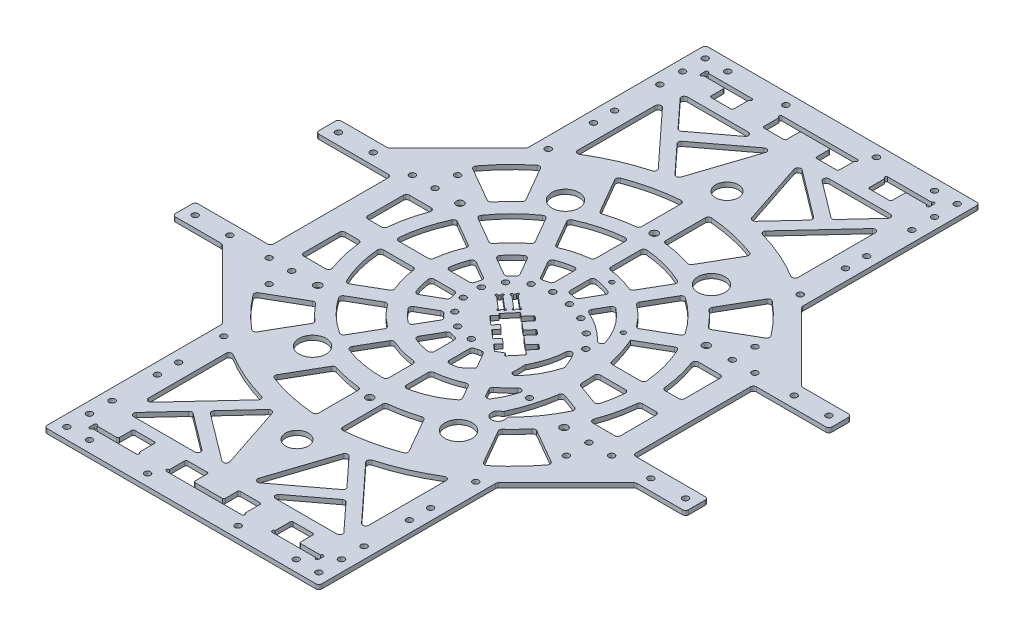
from build123d import *

# Parameters (mm, degrees)
EXTRUDE_2_OUTLINE_R   = 135
EXTRUDE_2_OUTLINE_R_2 = 2
EXTRUDE_2_DEPTH       = 3
SKETCH_7_R            = 2.5
SKETCH_7_R_2          = 1.5
CUT_EXTRUDE_3_DEPTH   = 191.942399692
EXTRUDE_START         = -3
SKETCH_8_R            = 135
EXTRUDE_3_DEPTH       = 3
SKETCH_9_R            = 0.75
SKETCH_9_R_2          = 2
SKETCH_9_W            = 31
SKETCH_9_H            = 3
SKETCH_9_W_2          = 50
SKETCH_9_H_2          = 80
CUT_EXTRUDE_4_DEPTH   = 278.254395817
FILLET_1_R            = 0.5
SKETCH_10_R           = 9
CUT_EXTRUDE_5_DEPTH   = 278.254395817
SKETCH_12_W           = 10
SKETCH_12_H           = 55
SKETCH_12_W_2         = 30
SKETCH_12_H_2         = 10
SKETCH_12_W_3         = 55
EXTRUDE_2_2_DEPTH     = 3
SKETCH_22_R           = 7.5
SKETCH_22_R_2         = 4.25
SKETCH_22_W           = 15
SKETCH_22_H           = 10
CUT_EXTRUDE_10_DEPTH  = 278.254395817
SKETCH_23_R           = 1
CUT_EXTRUDE_11_DEPTH  = 278.254395817
FILLET_2_R            = 2
FILLET_3_R            = 1
FILLET_5_R            = 2


with BuildPart() as part:
    # Extrude 2: read off the stored shape, not the designer's step
    # Extrude 2 outline → Extrude 2 (new body)
    with BuildSketch(Plane(origin=(0, 0, 0), x_dir=(1, 0, 0), z_dir=(0, 1, 0))):
        Circle(EXTRUDE_2_OUTLINE_R)
        with Locations((-11.714860956, -24.326159433)):
            Circle(EXTRUDE_2_OUTLINE_R_2, mode=Mode.SUBTRACT)
        with Locations((-21.109450027, -16.83422465)):
            Circle(EXTRUDE_2_OUTLINE_R_2, mode=Mode.SUBTRACT)
        with Locations((-26.323053629, -6.008065217)):
            Circle(EXTRUDE_2_OUTLINE_R_2, mode=Mode.SUBTRACT)
        with Locations((53.170264489, -41.583325675)):
            Circle(EXTRUDE_2_OUTLINE_R_2, mode=Mode.SUBTRACT)
        with Locations((0, -27)):
            Circle(EXTRUDE_2_OUTLINE_R_2, mode=Mode.SUBTRACT)
        with Locations((-26.323053629, 6.008065217)):
            Circle(EXTRUDE_2_OUTLINE_R_2, mode=Mode.SUBTRACT)
        with Locations((-21.109450027, 16.83422465)):
            Circle(EXTRUDE_2_OUTLINE_R_2, mode=Mode.SUBTRACT)
        with Locations((-11.714860956, 24.326159433)):
            Circle(EXTRUDE_2_OUTLINE_R_2, mode=Mode.SUBTRACT)
        with Locations((0, 27)):
            Circle(EXTRUDE_2_OUTLINE_R_2, mode=Mode.SUBTRACT)
        with Locations((12.54040261, 25.523692772)):
            Circle(EXTRUDE_2_OUTLINE_R_2, mode=Mode.SUBTRACT)
        with Locations((24.405378999, 21.203563613)):
            Circle(EXTRUDE_2_OUTLINE_R_2, mode=Mode.SUBTRACT)
        with Locations((43.695920987, 5.163960602)):
            Circle(EXTRUDE_2_OUTLINE_R_2, mode=Mode.SUBTRACT)
        with Locations((34.975533599, 14.296102982)):
            Circle(EXTRUDE_2_OUTLINE_R_2, mode=Mode.SUBTRACT)
    extrude(amount=EXTRUDE_2_DEPTH)

    # 草图7 → 切除-拉伸3 (cut, through all)
    with BuildSketch(Plane(origin=(0, 3, 0), x_dir=(1, 0, 0), z_dir=(0, 1, 0))):
        with Locations(Location((81.622894307, 47.125, 0), (0, 0, 270))):
            Circle(SKETCH_7_R)
        with Locations(Location((81.622894307, -47.125, 0), (0, 0, 270))):
            Circle(SKETCH_7_R)
        with Locations(Location((0, -94.25, 0), (0, 0, 270))):
            Circle(SKETCH_7_R)
        with Locations(Location((-81.622894307, -47.125, 0), (0, 0, 270))):
            Circle(SKETCH_7_R)
        with Locations(Location((-81.622894307, 47.125, 0), (0, 0, 270))):
            Circle(SKETCH_7_R)
        with Locations(Location((0, 94.25, 0), (0, 0, 270))):
            Circle(SKETCH_7_R)
        with Locations(Location((13.976228436, 52.15999462, 0), (0, 0, 270))):
            Circle(SKETCH_7_R_2)
        with Locations(Location((46.765371804, 27, 0), (0, 0, 270))):
            Circle(SKETCH_7_R_2)
        Polygon((1.215567157, 4.509929222), (-5.400270312, -3.253491067), (20.858357137, -25.630588388), (27.474194606, -17.867168099), align=None)
        Polygon((-10.201227386, 14.23910197), (-12.147061936, 11.955743062), (-3.013626301, 4.172404863), (-1.067791752, 6.455763772), align=None)
        Polygon((-7.68362922, -1.307656517), (-5.737794671, 0.975702391), (-14.871230305, 8.75904059), (-16.817064855, 6.475681681), align=None)
    extrude(amount=-CUT_EXTRUDE_3_DEPTH, mode=Mode.SUBTRACT)

    # 草图8 → 凸台-拉伸3 (add)
    with BuildSketch(Plane(origin=(0, 3, 0), x_dir=(1, 0, 0), z_dir=(0, 1, 0)).offset(EXTRUDE_START)):
        Polygon((170, 55), (170, -55), (137, -55), (91, -101), (91, -219), (-91, -219), (-91, -101), (-137, -55), (-170, -55), (-170, 55), (-137, 55), (-91, 101), (-91, 219), (91, 219), (91, 101), (137, 55), align=None)
        Circle(SKETCH_8_R, mode=Mode.SUBTRACT)
    extrude(amount=EXTRUDE_3_DEPTH)

    # 草图9 → 切除-拉伸4 (cut, through all)
    with BuildSketch(Plane(origin=(0, 3, 0), x_dir=(1, 0, 0), z_dir=(0, 1, 0))):
        with Locations((-3.013626301, 4.172404863)):
            Circle(SKETCH_9_R)
        with Locations((-1.067791752, 6.455763772)):
            Circle(SKETCH_9_R)
        with Locations((-10.201227386, 14.23910197)):
            Circle(SKETCH_9_R)
        with Locations((-12.147061936, 11.955743062)):
            Circle(SKETCH_9_R)
        with Locations((-14.871230305, 8.75904059)):
            Circle(SKETCH_9_R)
        with Locations((-16.817064855, 6.475681681)):
            Circle(SKETCH_9_R)
        with Locations((-5.737794671, 0.975702391)):
            Circle(SKETCH_9_R)
        with Locations((-7.68362922, -1.307656517)):
            Circle(SKETCH_9_R)
        with Locations(Location((162.5, 47.5, 0), (0, 0, 270))):
            Circle(SKETCH_9_R_2)
        with Locations(Location((139.5, 47.5, 0), (0, 0, 270))):
            Circle(SKETCH_9_R_2)
        with Locations(Location((98.5, 62.5, 0), (0, 0, 270))):
            Circle(SKETCH_9_R_2)
        with Locations(Location((98.5, 47.5, 0), (0, 0, 270))):
            Circle(SKETCH_9_R_2)
        with Locations(Location((113.5, 47.5, 0), (0, 0, 270))):
            Circle(SKETCH_9_R_2)
        with Locations(Location((162.5, -47.5, 0), (0, 0, 90))):
            Circle(SKETCH_9_R_2)
        with Locations(Location((139.5, -47.5, 0), (0, 0, 90))):
            Circle(SKETCH_9_R_2)
        with Locations(Location((113.5, -47.5, 0), (0, 0, 90))):
            Circle(SKETCH_9_R_2)
        with Locations(Location((98.5, -47.5, 0), (0, 0, 90))):
            Circle(SKETCH_9_R_2)
        with Locations(Location((98.5, -62.5, 0), (0, 0, 90))):
            Circle(SKETCH_9_R_2)
        with Locations(Location((-98.5, -62.5, 0), (0, 0, 270))):
            Circle(SKETCH_9_R_2)
        with Locations(Location((-98.5, -47.5, 0), (0, 0, 270))):
            Circle(SKETCH_9_R_2)
        with Locations(Location((-113.5, -47.5, 0), (0, 0, 270))):
            Circle(SKETCH_9_R_2)
        with Locations(Location((-139.5, -47.5, 0), (0, 0, 270))):
            Circle(SKETCH_9_R_2)
        with Locations(Location((-162.5, -47.5, 0), (0, 0, 270))):
            Circle(SKETCH_9_R_2)
        with Locations(Location((-113.5, 47.5, 0), (0, 0, 90))):
            Circle(SKETCH_9_R_2)
        with Locations(Location((-98.5, 47.5, 0), (0, 0, 90))):
            Circle(SKETCH_9_R_2)
        with Locations(Location((-98.5, 62.5, 0), (0, 0, 90))):
            Circle(SKETCH_9_R_2)
        with Locations(Location((-139.5, 47.5, 0), (0, 0, 90))):
            Circle(SKETCH_9_R_2)
        with Locations(Location((-162.5, 47.5, 0), (0, 0, 90))):
            Circle(SKETCH_9_R_2)
        with Locations(Location((68.5, 211.5, 0), (0, 0, 270))):
            Circle(SKETCH_9_R_2)
        with Locations(Location((83.5, 211.5, 0), (0, 0, 270))):
            Circle(SKETCH_9_R_2)
        with Locations(Location((83.5, 196.5, 0), (0, 0, 270))):
            Circle(SKETCH_9_R_2)
        with Locations(Location((83.5, 181.5, 0), (0, 0, 270))):
            Circle(SKETCH_9_R_2)
        with Locations(Location((83.5, 151.5, 0), (0, 0, 270))):
            Circle(SKETCH_9_R_2)
        with Locations(Location((83.5, -181.5, 0), (0, 0, 90))):
            Circle(SKETCH_9_R_2)
        with Locations(Location((83.5, -196.5, 0), (0, 0, 90))):
            Circle(SKETCH_9_R_2)
        with Locations(Location((83.5, -211.5, 0), (0, 0, 90))):
            Circle(SKETCH_9_R_2)
        with Locations(Location((68.5, -211.5, 0), (0, 0, 90))):
            Circle(SKETCH_9_R_2)
        with Locations(Location((-83.5, 181.5, 0), (0, 0, 90))):
            Circle(SKETCH_9_R_2)
        with Locations(Location((-83.5, 196.5, 0), (0, 0, 90))):
            Circle(SKETCH_9_R_2)
        with Locations(Location((-83.5, 211.5, 0), (0, 0, 90))):
            Circle(SKETCH_9_R_2)
        with Locations(Location((-68.5, 211.5, 0), (0, 0, 90))):
            Circle(SKETCH_9_R_2)
        with Locations(Location((-68.5, -211.5, 0), (0, 0, 270))):
            Circle(SKETCH_9_R_2)
        with Locations(Location((-83.5, -211.5, 0), (0, 0, 270))):
            Circle(SKETCH_9_R_2)
        with Locations(Location((-83.5, -196.5, 0), (0, 0, 270))):
            Circle(SKETCH_9_R_2)
        with Locations(Location((-83.5, -181.5, 0), (0, 0, 270))):
            Circle(SKETCH_9_R_2)
        with Locations(Location((30, 211.5, 0), (0, 0, 270))):
            Circle(SKETCH_9_R_2)
        with Locations(Location((-30, 211.5, 0), (0, 0, 90))):
            Circle(SKETCH_9_R_2)
        with Locations(Location((-30, -211.5, 0), (0, 0, 270))):
            Circle(SKETCH_9_R_2)
        with Locations(Location((30, -211.5, 0), (0, 0, 90))):
            Circle(SKETCH_9_R_2)
        with Locations(Location((83.5, 137.5, 0), (0, 0, 270))):
            Circle(SKETCH_9_R_2)
        with Locations(Location((83.5, 107.5, 0), (0, 0, 270))):
            Circle(SKETCH_9_R_2)
        with Locations(Location((-83.5, 107.5, 0), (0, 0, 90))):
            Circle(SKETCH_9_R_2)
        with Locations(Location((-83.5, 137.5, 0), (0, 0, 90))):
            Circle(SKETCH_9_R_2)
        with Locations(Location((-83.5, 151.5, 0), (0, 0, 90))):
            Circle(SKETCH_9_R_2)
        with Locations(Location((83.5, -151.5, 0), (0, 0, 90))):
            Circle(SKETCH_9_R_2)
        with Locations(Location((-83.5, -151.5, 0), (0, 0, 270))):
            Circle(SKETCH_9_R_2)
        with Locations(Location((83.5, -107.5, 0), (0, 0, 90))):
            Circle(SKETCH_9_R_2)
        with Locations(Location((83.5, -137.5, 0), (0, 0, 90))):
            Circle(SKETCH_9_R_2)
        with Locations(Location((-83.5, -137.5, 0), (0, 0, 270))):
            Circle(SKETCH_9_R_2)
        with Locations(Location((-83.5, -107.5, 0), (0, 0, 270))):
            Circle(SKETCH_9_R_2)
        Polygon((16.391664776, 0.117201019), (5.559852449, -12.593496905), (4.30400505, -11.523287903), (1.385253225, -14.948326266), (7.093650497, -19.81291264), (10.012402321, -16.387874277), (8.756554921, -15.317665275), (19.588367248, -2.606967351), align=None)
        Polygon((-4.296646839, -4.193977766), (-7.215398664, -7.619016129), (-1.507001392, -12.483602503), (1.411750432, -9.05856414), (0.155903032, -7.988355138), (10.987715359, 4.722342786), (7.791012887, 7.446511156), (-3.04079944, -5.264186768), align=None)
        Polygon((17.813878592, -23.036142322), (28.645690918, -10.325444398), (25.448988446, -7.601276028), (14.61717612, -20.311973952), (13.36132872, -19.24176495), (10.442576896, -22.666803313), (16.150974167, -27.531389687), (19.069725992, -24.106351324), align=None)
        with Locations((-60.5, 202.5)):
            Rectangle(SKETCH_9_W, SKETCH_9_H)
        with Locations((60.5, 202.5)):
            Rectangle(SKETCH_9_W, SKETCH_9_H)
        with Locations((-145, 0)):
            Rectangle(SKETCH_9_W_2, SKETCH_9_H_2)
        with Locations((145, 0)):
            Rectangle(SKETCH_9_W_2, SKETCH_9_H_2)
        with Locations((0, 202.5)):
            Rectangle(SKETCH_9_W_2, SKETCH_9_H)
        with Locations((-60.5, -202.5)):
            Rectangle(SKETCH_9_W, SKETCH_9_H)
        with Locations((0, -202.5)):
            Rectangle(SKETCH_9_W_2, SKETCH_9_H)
        with Locations((60.5, -202.5)):
            Rectangle(SKETCH_9_W, SKETCH_9_H)
    extrude(amount=-CUT_EXTRUDE_4_DEPTH, mode=Mode.SUBTRACT)

    # 圆角1
    fillet_1_edges = [part.edges().sort_by_distance(p)[0] for p in [
        (1.215567157, 1.5, -4.509929222),
        (27.474194606, 1.5, 17.867168099),
        (20.858357137, 1.5, 25.630588388),
        (-5.400270312, 1.5, 3.253491067),
        (19.588367248, 1.5, 2.606967351),
        (1.385253225, 1.5, 14.948326266),
        (16.391664776, 1.5, -0.117201019),
        (7.093650497, 1.5, 19.81291264),
        (28.645690918, 1.5, 10.325444398),
        (10.442576896, 1.5, 22.666803313),
        (25.448988446, 1.5, 7.601276028),
        (16.150974167, 1.5, 27.531389687),
        (10.987715359, 1.5, -4.722342786),
        (7.791012887, 1.5, -7.446511156),
        (-1.507001392, 1.5, 12.483602503),
        (-7.215398664, 1.5, 7.619016129),
    ]]
    fillet(fillet_1_edges, radius=FILLET_1_R)

    # 草图10 → 切除-拉伸5 (cut, through all)
    with BuildSketch(Plane(origin=(0, 3, 0), x_dir=(1, 0, 0), z_dir=(0, 1, 0))):
        with Locations(Location((-48.375, 83.787957816, 0), (0, 0, 270))):
            Circle(SKETCH_10_R)
        with Locations(Location((48.375, 83.787957816, 0), (0, 0, 270))):
            Circle(SKETCH_10_R)
        with Locations(Location((48.375, -83.787957816, 0), (0, 0, 270))):
            Circle(SKETCH_10_R)
        with Locations(Location((-48.375, -83.787957816, 0), (0, 0, 270))):
            Circle(SKETCH_10_R)
        with BuildLine():
            ThreePointArc((54.807599699, 21.843237289), (-58.035185112, 10.626254705), (43.512352912, -39.845641469))
            ThreePointArc((43.512352912, -39.845641469), (45.966882899, -39.452635002), (46.908234228, -41.753293433))
            ThreePointArc((46.908234228, -41.753293433), (35.725023116, -61.49758579), (16.859238941, -74.106450882))
            ThreePointArc((16.859238941, -74.106450882), (-26.987401916, -76.117709483), (-63.833064957, -52.264613442))
            ThreePointArc((-63.833064957, -52.264613442), (6.543748569, 82.240071466), (54.764925772, -61.701320125))
            ThreePointArc((54.764925772, -61.701320125), (52.225261686, -61.796437344), (51.642704378, -59.322661297))
            ThreePointArc((51.642704378, -59.322661297), (61.837427116, -19.075529749), (54.807599699, 21.843237289))
        make_face()
        with BuildLine():
            ThreePointArc((48.483149933, 7.098180936), (-40.861999704, 27.042503216), (12.415555235, -47.400991426))
            ThreePointArc((12.415555235, -47.400991426), (18.681796727, -41.317756254), (22.242880009, -33.343408729))
            ThreePointArc((22.242880009, -33.343408729), (22.008638881, -31.855621383), (20.802882397, -30.953107455))
            ThreePointArc((20.802882397, -30.953107455), (14.460540203, -30.135222653), (8.118198009, -30.953107455))
            ThreePointArc((8.118198009, -30.953107455), (-31.737197725, -4.092710662), (4.1e-08, 32))
            ThreePointArc((4.1e-08, 32), (6.898084414, 31.595361796), (13.701550903, 30.386997681))
            ThreePointArc((13.701550903, 30.386997681), (33.185077819, 21.868055327), (48.483149933, 7.098180936))
        make_face()
        with BuildLine():
            ThreePointArc((31.462480379, -37.564775101), (32.728244708, -30.923894341), (32.618689385, -24.164348924))
            ThreePointArc((32.618689385, -24.164348924), (37.70981937, -10.922222356), (38.876667523, 3.216801159))
            ThreePointArc((38.876667523, 3.216801159), (43.832931918, -4.268743283), (47.373891096, -12.518563914))
            ThreePointArc((47.373891096, -12.518563914), (41.359660788, -26.275053939), (31.462480379, -37.564775101))
        make_face()
    extrude(amount=-CUT_EXTRUDE_5_DEPTH, mode=Mode.SUBTRACT)

    # 草图12 → Extrude 2 2 (add)
    with BuildSketch(Plane(origin=(0, 3, 0), x_dir=(1, 0, 0), z_dir=(0, 1, 0))):
        with Locations((0, 56.5)):
            Rectangle(SKETCH_12_W, SKETCH_12_H)
        Polygon((19.700243076, 24.121821929), (46.330127019, 70.246133918), (37.669872981, 75.246133918), (11.039989038, 29.121821929), align=None)
        Polygon((50.997422612, 23.669872981), (75.246133918, 37.669872981), (70.246133918, 46.330127019), (45.997422612, 32.330127019), align=None)
        with Locations((69, 0)):
            Rectangle(SKETCH_12_W_2, SKETCH_12_H_2)
        Polygon((10.798129487, -28.702908898), (37.669872981, -75.246133918), (46.330127019, -70.246133918), (19.458383525, -23.702908898), align=None)
        with Locations((0, -56.5)):
            Rectangle(SKETCH_12_W, SKETCH_12_H)
        Polygon((-18.792378281, -22.549353978), (-46.330127019, -70.246133918), (-37.669872981, -75.246133918), (-10.132124243, -27.549353978), align=None)
        Polygon((-27.61473671, -10.169872981), (-75.246133918, -37.669872981), (-70.246133918, -46.330127019), (-22.61473671, -18.830127019), align=None)
        with Locations((-56.5, 0)):
            Rectangle(SKETCH_12_W_3, SKETCH_12_H_2)
        Polygon((-22.61473671, 18.830127019), (-70.246133918, 46.330127019), (-75.246133918, 37.669872981), (-27.61473671, 10.169872981), align=None)
        Polygon((-10.169872981, 27.61473671), (-37.669872981, 75.246133918), (-46.330127019, 70.246133918), (-18.830127019, 22.61473671), align=None)
        Polygon((49.033300806, -23.167550844), (77.224079429, -33.428155143), (80.644280863, -24.031228935), (52.453502239, -13.770624636), align=None)
    extrude(amount=-EXTRUDE_2_2_DEPTH)

    # 草图22 → 切除-拉伸10 (cut, through all)
    with BuildSketch(Plane(origin=(0, 3, 0), x_dir=(1, 0, 0), z_dir=(0, 1, 0))):
        with Locations(Location((0, 142.5, 0), (0, 0, 270))):
            Circle(SKETCH_22_R)
        with Locations((53.155598978, -62.437827455)):
            Circle(SKETCH_22_R_2)
        with Locations(Location((0, -142.5, 0), (0, 0, 90))):
            Circle(SKETCH_22_R)
        with BuildLine():
            Line((-105, 7.5), (-105, 35))
            Line((-105, 35), (-85.622718948, 35))
            ThreePointArc((-85.622718948, 35), (-89.966034254, 21.502620318), (-92.195444573, 7.5))
            Line((-92.195444573, 7.5), (-105, 7.5))
        make_face()
        with BuildLine():
            Line((29.77741647, 87.575998244), (44.996710059, 113.936587995))
            ThreePointArc((44.996710059, 113.936587995), (26.821507042, 119.527640151), (8, 122.238496391))
            Line((8, 122.238496391), (8, 92.153404712))
            ThreePointArc((8, 92.153404712), (19.026861572, 90.521978208), (29.77741647, 87.575998244))
        make_face()
        with BuildLine():
            Line((92.195444573, 7.5), (105, 7.5))
            Line((105, 7.5), (105, 35))
            Line((105, 35), (85.622718948, 35))
            ThreePointArc((85.622718948, 35), (89.966034254, 21.502620318), (92.195444573, 7.5))
        make_face()
        with BuildLine():
            Line((72.812278368, 57.049295515), (98.989039715, 72.162455725))
            ThreePointArc((98.989039715, 72.162455725), (88.384342976, 84.820150417), (76.173624595, 95.936587995))
            Line((76.173624595, 95.936587995), (60.954331006, 69.575998244))
            ThreePointArc((60.954331006, 69.575998244), (67.175933311, 63.589653119), (72.812278368, 57.049295515))
        make_face()
        with BuildLine():
            Line((105, -35), (85.622718948, -35))
            ThreePointArc((85.622718948, -35), (89.966034254, -21.502620318), (92.195444573, -7.5))
            Line((92.195444573, -7.5), (105, -7.5))
            Line((105, -7.5), (105, -35))
        make_face()
        with BuildLine():
            Line((33.504478555, 130.260124047), (73, 172.96570276))
            Line((73, 172.96570276), (73, 112.96570276))
            ThreePointArc((73, 112.96570276), (53.949747358, 123.205822752), (33.504478555, 130.260124047))
        make_face()
        with BuildLine():
            Line((-73, 172.96570276), (-73, 112.96570276))
            ThreePointArc((-73, 112.96570276), (-53.949747358, 123.205822752), (-33.504478555, 130.260124047))
            Line((-33.504478555, 130.260124047), (-73, 172.96570276))
        make_face()
        with BuildLine():
            Line((-60.954331006, 69.575998244), (-76.173624595, 95.936587995))
            ThreePointArc((-76.173624595, 95.936587995), (-88.384342976, 84.820150417), (-98.989039715, 72.162455725))
            Line((-98.989039715, 72.162455725), (-72.812278368, 57.049295515))
            ThreePointArc((-72.812278368, 57.049295515), (-67.175933311, 63.589653119), (-60.954331006, 69.575998244))
        make_face()
        with BuildLine():
            Line((-8, 92.153404712), (-8, 122.238496391))
            ThreePointArc((-8, 122.238496391), (-26.821507042, 119.527640151), (-44.996710059, 113.936587995))
            Line((-44.996710059, 113.936587995), (-29.77741647, 87.575998244))
            ThreePointArc((-29.77741647, 87.575998244), (-19.026861572, 90.521978208), (-8, 92.153404712))
        make_face()
        with BuildLine():
            Line((72.812278368, -57.049295515), (98.989039715, -72.162455725))
            ThreePointArc((98.989039715, -72.162455725), (88.384342976, -84.820150417), (76.173624595, -95.936587995))
            Line((76.173624595, -95.936587995), (60.954331006, -69.575998244))
            ThreePointArc((60.954331006, -69.575998244), (67.175933311, -63.589653119), (72.812278368, -57.049295515))
        make_face()
        with BuildLine():
            Line((-29.77741647, -87.575998244), (-44.996710059, -113.936587995))
            ThreePointArc((-44.996710059, -113.936587995), (-26.821507042, -119.527640151), (-8, -122.238496391))
            Line((-8, -122.238496391), (-8, -92.153404712))
            ThreePointArc((-8, -92.153404712), (-19.026861572, -90.521978208), (-29.77741647, -87.575998244))
        make_face()
        with BuildLine():
            Line((-72.812278368, -57.049295515), (-98.989039715, -72.162455725))
            ThreePointArc((-98.989039715, -72.162455725), (-88.384342976, -84.820150417), (-76.173624595, -95.936587995))
            Line((-76.173624595, -95.936587995), (-60.954331006, -69.575998244))
            ThreePointArc((-60.954331006, -69.575998244), (-67.175933311, -63.589653119), (-72.812278368, -57.049295515))
        make_face()
        with BuildLine():
            Line((8, -92.153404712), (8, -122.238496391))
            ThreePointArc((8, -122.238496391), (26.821507042, -119.527640151), (44.996710059, -113.936587995))
            Line((44.996710059, -113.936587995), (29.77741647, -87.575998244))
            ThreePointArc((29.77741647, -87.575998244), (19.026861572, -90.521978208), (8, -92.153404712))
        make_face()
        with BuildLine():
            Line((-92.195444573, -7.5), (-105, -7.5))
            Line((-105, -7.5), (-105, -35))
            Line((-105, -35), (-85.622718948, -35))
            ThreePointArc((-85.622718948, -35), (-89.966034254, -21.502620318), (-92.195444573, -7.5))
        make_face()
        with Locations((-52.5, 196)):
            Rectangle(SKETCH_22_W, SKETCH_22_H)
        with Locations((-17.5, 196)):
            Rectangle(SKETCH_22_W, SKETCH_22_H)
        with Locations((17.5, 196)):
            Rectangle(SKETCH_22_W, SKETCH_22_H)
        with Locations((52.5, 196)):
            Rectangle(SKETCH_22_W, SKETCH_22_H)
        with Locations((52.5, -196)):
            Rectangle(SKETCH_22_W, SKETCH_22_H)
        with Locations((17.5, -196)):
            Rectangle(SKETCH_22_W, SKETCH_22_H)
        with Locations((-17.5, -196)):
            Rectangle(SKETCH_22_W, SKETCH_22_H)
        with Locations((-52.5, -196)):
            Rectangle(SKETCH_22_W, SKETCH_22_H)
        Polygon((20.793956755, 183.5), (71.845665855, 183.5), (50.880248519, 160.830587178), align=None)
        Polygon((7.5, 183.5), (45.420816185, 154.927431358), (24.455398849, 132.258018536), align=None)
        Polygon((-20.793956755, 183.5), (-71.845665855, 183.5), (-50.880248519, 160.830587178), align=None)
        Polygon((-24.455398849, 132.258018536), (-7.5, 183.5), (-45.420816185, 154.927431358), align=None)
        with BuildLine():
            Line((-73, -172.96570276), (-73, -112.96570276))
            ThreePointArc((-73, -112.96570276), (-53.949747358, -123.205822752), (-33.504478555, -130.260124047))
            Line((-33.504478555, -130.260124047), (-73, -172.96570276))
        make_face()
        Polygon((-20.793956755, -183.5), (-71.845665855, -183.5), (-50.880248519, -160.830587178), align=None)
        Polygon((-7.5, -183.5), (-45.420816185, -154.927431358), (-24.455398849, -132.258018536), align=None)
        Polygon((24.455398849, -132.258018536), (7.5, -183.5), (45.420816185, -154.927431358), align=None)
        Polygon((50.880248519, -160.830587178), (20.793956755, -183.5), (71.845665855, -183.5), align=None)
        with BuildLine():
            Line((73, -172.96570276), (73, -112.96570276))
            ThreePointArc((73, -112.96570276), (53.949747358, -123.205822752), (33.504478555, -130.260124047))
            Line((33.504478555, -130.260124047), (73, -172.96570276))
        make_face()
    extrude(amount=-CUT_EXTRUDE_10_DEPTH, mode=Mode.SUBTRACT)

    # 草图23 → 切除-拉伸11 (cut, through all)
    with BuildSketch(Plane(origin=(0, 3, 0), x_dir=(1, 0, 0), z_dir=(0, 1, 0))):
        with Locations((75, 204)):
            Circle(SKETCH_23_R)
        with Locations((75, 201)):
            Circle(SKETCH_23_R)
        with Locations((45, 203)):
            Circle(SKETCH_23_R)
        with Locations((25, 203)):
            Circle(SKETCH_23_R)
        with Locations((-25, 203)):
            Circle(SKETCH_23_R)
        with Locations((-45, 203)):
            Circle(SKETCH_23_R)
        with Locations((-75, 201)):
            Circle(SKETCH_23_R)
        with Locations((-75, 204)):
            Circle(SKETCH_23_R)
        with Locations((-75, -204)):
            Circle(SKETCH_23_R)
        with Locations((-75, -201)):
            Circle(SKETCH_23_R)
        with Locations((-45, -203)):
            Circle(SKETCH_23_R)
        with Locations((-25, -203)):
            Circle(SKETCH_23_R)
        with Locations((25, -203)):
            Circle(SKETCH_23_R)
        with Locations((45, -203)):
            Circle(SKETCH_23_R)
        with Locations((75, -201)):
            Circle(SKETCH_23_R)
        with Locations((75, -204)):
            Circle(SKETCH_23_R)
    extrude(amount=-CUT_EXTRUDE_11_DEPTH, mode=Mode.SUBTRACT)

    # 圆角2
    fillet_2_edges = [part.edges().sort_by_distance(p)[0] for p in [
        (91, 1.5, -101),
        (91, 1.5, -219),
        (-91, 1.5, -219),
        (-91, 1.5, -101),
        (-137, 1.5, -55),
        (-170, 1.5, -55),
        (-170, 1.5, 55),
        (-137, 1.5, 55),
        (-91, 1.5, 101),
        (-91, 1.5, 219),
        (91, 1.5, 219),
        (91, 1.5, 101),
        (137, 1.5, 55),
        (170, 1.5, 55),
        (170, 1.5, -55),
        (137, 1.5, -55),
        (52.132492981, 1.5, 58.312811804),
        (56.631666777, 1.5, 59.992535519),
        (-170, 1.5, 40),
        (-170, 1.5, -40),
        (170, 1.5, -40),
        (170, 1.5, 40),
    ]]
    fillet(fillet_2_edges, radius=FILLET_2_R)

    # 圆角3
    fillet_3_edges = [part.edges().sort_by_distance(p)[0] for p in [
        (45, 1.5, 191),
        (60, 1.5, 191),
        (60, 1.5, 201),
        (60, 1.5, -201),
        (60, 1.5, -191),
        (45, 1.5, -191),
        (25, 1.5, 191),
        (10, 1.5, 201),
        (10, 1.5, 191),
        (-10, 1.5, 201),
        (-25, 1.5, 191),
        (-10, 1.5, 191),
        (-60, 1.5, 201),
        (-60, 1.5, 191),
        (-45, 1.5, 191),
        (-45, 1.5, -191),
        (-60, 1.5, -191),
        (-60, 1.5, -201),
        (-25, 1.5, -191),
        (-10, 1.5, -201),
        (-10, 1.5, -191),
        (10, 1.5, -201),
        (25, 1.5, -191),
        (10, 1.5, -191),
    ]]
    fillet(fillet_3_edges, radius=FILLET_3_R)

    # 圆角5
    fillet_5_edges = [part.edges().sort_by_distance(p)[0] for p in [
        (68.815759128, 1.5, -45.504299749),
        (73.815759128, 1.5, -36.844045711),
        (28.702242233, 1.5, -39.713741838),
        (20.041988195, 1.5, -44.713741838),
        (36.844045711, 1.5, -73.815759128),
        (25.063749894, 1.5, -53.411688245),
        (11.990804111, 1.5, -30.768681943),
        (33.724003932, 1.5, -48.411688245),
        (21.836777721, 1.5, -27.822408486),
        (45.504299749, 1.5, -68.815759128),
        (31.877025819, 1.5, 65.212628312),
        (39.010317683, 1.5, 57.567852247),
        (33.724003932, 1.5, 48.411688245),
        (11.712538572, 1.5, 30.286711892),
        (25.063749894, 1.5, 53.411688245),
        (61.393933446, 1.5, 5),
        (59.856203068, 1.5, -5),
        (82.34834546, 1.5, -5),
        (82.34834546, 1.5, 5),
        (-5, 1.5, 78.543952843),
        (5, 1.5, 77.392922847),
        (5, 1.5, 31.606961259),
        (5, 1.5, 48.744230428),
        (5, 1.5, 58.787753827),
        (-5, 1.5, 31.606961259),
        (-5, 1.5, 48.744230428),
        (-5, 1.5, 58.787753827),
        (-45.232822915, 1.5, 68.345547458),
        (-36.311139386, 1.5, 72.892738297),
        (-11.47335361, 1.5, 29.872431386),
        (-20.041988195, 1.5, 44.713741838),
        (-25.063749894, 1.5, 53.411688245),
        (-20.133607648, 1.5, 24.872431386),
        (-28.702242233, 1.5, 39.713741838),
        (-33.724003932, 1.5, 48.411688245),
        (-24.872431386, 1.5, 20.133607648),
        (-39.713741838, 1.5, 28.702242233),
        (-68.815759128, 1.5, 45.504299749),
        (-48.411688245, 1.5, 33.724003932),
        (-29.872431386, 1.5, 11.47335361),
        (-53.411688245, 1.5, 25.063749894),
        (-44.713741838, 1.5, 20.041988195),
        (-73.815759128, 1.5, 36.844045711),
        (-31.606961259, 1.5, 5),
        (-48.744230428, 1.5, 5),
        (-82.34834546, 1.5, 5),
        (-58.787753827, 1.5, 5),
        (-31.606961259, 1.5, -5),
        (-58.787753827, 1.5, -5),
        (-48.744230428, 1.5, -5),
        (-82.34834546, 1.5, -5),
        (-29.872431386, 1.5, -11.47335361),
        (-44.713741838, 1.5, -20.041988195),
        (-73.815759128, 1.5, -36.844045711),
        (-53.411688245, 1.5, -25.063749894),
        (-24.872431386, 1.5, -20.133607648),
        (-48.411688245, 1.5, -33.724003932),
        (-39.713741838, 1.5, -28.702242233),
        (-68.815759128, 1.5, -45.504299749),
        (-20.133607648, 1.5, -24.872431386),
        (-28.702242233, 1.5, -39.713741838),
        (-45.504299749, 1.5, -68.815759128),
        (-33.724003932, 1.5, -48.411688245),
        (-11.47335361, 1.5, -29.872431386),
        (-25.063749894, 1.5, -53.411688245),
        (-20.041988195, 1.5, -44.713741838),
        (-36.844045711, 1.5, -73.815759128),
        (61.142133613, 1.5, 27.574805557),
        (61.892816049, 1.5, 17.206253894),
        (79.092233279, 1.5, 23.466329813),
        (75.672031846, 1.5, 32.863256021),
        (8, 1.5, 92.153404712),
        (29.77741647, 1.5, 87.575998244),
        (44.996710059, 1.5, 113.936587995),
        (8, 1.5, 122.238496391),
        (33.504478555, 1.5, 130.260124047),
        (73, 1.5, 112.96570276),
        (73, 1.5, 172.96570276),
        (-105, 1.5, 35),
        (-105, 1.5, 7.5),
        (-92.195444573, 1.5, 7.5),
        (-85.622718948, 1.5, 35),
        (-8, 1.5, 122.238496391),
        (-44.996710059, 1.5, 113.936587995),
        (-29.77741647, 1.5, 87.575998244),
        (-8, 1.5, 92.153404712),
        (-72.812278368, 1.5, 57.049295515),
        (-60.954331006, 1.5, 69.575998244),
        (-76.173624595, 1.5, 95.936587995),
        (-98.989039715, 1.5, 72.162455725),
        (-73, 1.5, 112.96570276),
        (-33.504478555, 1.5, 130.260124047),
        (-73, 1.5, 172.96570276),
        (-50.880248519, 1.5, 160.830587178),
        (-20.793956755, 1.5, 183.5),
        (-71.845665855, 1.5, 183.5),
        (-24.455398849, 1.5, 132.258018536),
        (-7.5, 1.5, 183.5),
        (-45.420816185, 1.5, 154.927431358),
        (-20.793956755, 1.5, -183.5),
        (-50.880248519, 1.5, -160.830587178),
        (-71.845665855, 1.5, -183.5),
        (-24.455398849, 1.5, -132.258018536),
        (-45.420816185, 1.5, -154.927431358),
        (-7.5, 1.5, -183.5),
        (-85.622718948, 1.5, -35),
        (-92.195444573, 1.5, -7.5),
        (-105, 1.5, -7.5),
        (-105, 1.5, -35),
        (73, 1.5, -112.96570276),
        (33.504478555, 1.5, -130.260124047),
        (73, 1.5, -172.96570276),
        (105, 1.5, -35),
        (105, 1.5, -7.5),
        (92.195444573, 1.5, -7.5),
        (85.622718948, 1.5, -35),
        (50.880248519, 1.5, -160.830587178),
        (20.793956755, 1.5, -183.5),
        (71.845665855, 1.5, -183.5),
        (105, 1.5, 7.5),
        (105, 1.5, 35),
        (85.622718948, 1.5, 35),
        (92.195444573, 1.5, 7.5),
        (76.173624595, 1.5, -95.936587995),
        (98.989039715, 1.5, -72.162455725),
        (72.812278368, 1.5, -57.049295515),
        (60.954331006, 1.5, -69.575998244),
        (60.954331006, 1.5, 69.575998244),
        (72.812278368, 1.5, 57.049295515),
        (98.989039715, 1.5, 72.162455725),
        (76.173624595, 1.5, 95.936587995),
        (24.455398849, 1.5, -132.258018536),
        (7.5, 1.5, -183.5),
        (45.420816185, 1.5, -154.927431358),
        (-33.504478555, 1.5, -130.260124047),
        (-73, 1.5, -112.96570276),
        (-73, 1.5, -172.96570276),
        (-98.989039715, 1.5, -72.162455725),
        (-76.173624595, 1.5, -95.936587995),
        (-60.954331006, 1.5, -69.575998244),
        (-72.812278368, 1.5, -57.049295515),
        (-8, 1.5, -92.153404712),
        (-29.77741647, 1.5, -87.575998244),
        (-44.996710059, 1.5, -113.936587995),
        (-8, 1.5, -122.238496391),
        (50.880248519, 1.5, 160.830587178),
        (71.845665855, 1.5, 183.5),
        (20.793956755, 1.5, 183.5),
        (24.455398849, 1.5, 132.258018536),
        (45.420816185, 1.5, 154.927431358),
        (7.5, 1.5, 183.5),
        (29.77741647, 1.5, -87.575998244),
        (8, 1.5, -92.153404712),
        (8, 1.5, -122.238496391),
        (44.996710059, 1.5, -113.936587995),
        (-120, 1.5, -40),
        (-120, 1.5, 40),
        (120, 1.5, -40),
        (120, 1.5, 40),
        (48.483149933, 1.5, -7.098180936),
        (47.373891096, 1.5, 12.518563914),
        (31.462480379, 1.5, 37.564775101),
        (32.618689385, 1.5, 24.164348924),
        (38.876667523, 1.5, -3.216801159),
        (5, 1.5, -58.787753827),
        (-5, 1.5, -58.787753827),
        (-5, 1.5, -31.606961259),
        (-5, 1.5, -48.744230428),
        (-5, 1.5, -82.34834546),
        (5, 1.5, -31.787753768),
        (5, 1.5, -48.744230428),
        (5, 1.5, -82.34834546),
        (48.411688245, 1.5, -33.724003932),
    ]]
    fillet(fillet_5_edges, radius=FILLET_5_R)


solid = part.part
